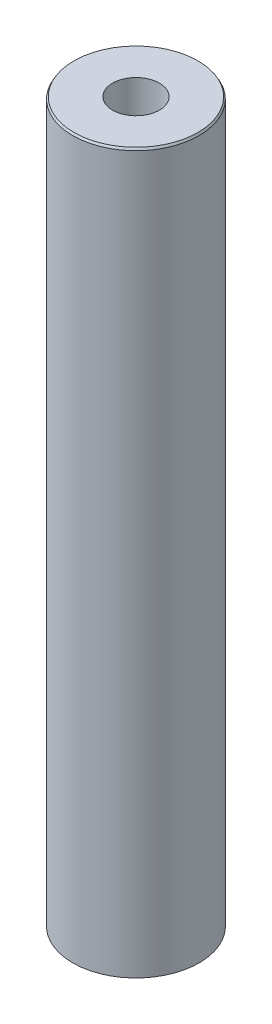
from build123d import *
from OCP.BRepFilletAPI import BRepFilletAPI_MakeChamfer

# Parameters (mm, degrees)
SKETCH1_R           = 50
BOSS_EXTRUDE1_DEPTH = 568.919930684
SKETCH2_R           = 18.52179034
CUT_EXTRUDE1_DEPTH  = 574.297381408
CHAMFER1_SIZE       = 1.673068569
CHAMFER1_SIZE2      = 0.965946588


with BuildPart() as part:
    # Sketch1 → Boss-Extrude1 (new body)
    with BuildSketch(Plane(origin=(0, 0, 0), x_dir=(1, 0, 0), z_dir=(0, 1, 0))):
        Circle(SKETCH1_R)
    extrude(amount=BOSS_EXTRUDE1_DEPTH)

    # Sketch2 → Cut-Extrude1 (cut, through all)
    with BuildSketch(Plane(origin=(0, 0, 0), x_dir=(1, 0, 0), z_dir=(0, 1, 0))):
        Circle(SKETCH2_R)
    extrude(amount=CUT_EXTRUDE1_DEPTH, mode=Mode.SUBTRACT)

    # Chamfer1: one chamfer whose edges measure the first distance from different faces: ONE call of the kernel's chamfer builder (chamfer() names one face for all edges)
    chamfer1_edges_1 = [part.edges().sort_by_distance(p)[0] for p in [
        (-50, 568.919930684, 0),
    ]]
    chamfer1_side_1 = [part.faces().sort_by_distance(p)[0] for p in [
        (-50, 284.459965342, 0),
    ]]
    chamfer1_edges_2 = [part.edges().sort_by_distance(p)[0] for p in [
        (-50, 0, 0),
    ]]
    chamfer1_side_2 = [part.faces().sort_by_distance(p)[0] for p in [
        (-48.585786438, 0, 0),
    ]]
    chamfer1 = BRepFilletAPI_MakeChamfer(part.part.solid().wrapped)
    for e in chamfer1_edges_1:
        chamfer1.Add(CHAMFER1_SIZE, CHAMFER1_SIZE2, e.wrapped, chamfer1_side_1[0].wrapped)  # the first distance lies on this face
    for e in chamfer1_edges_2:
        chamfer1.Add(CHAMFER1_SIZE, CHAMFER1_SIZE2, e.wrapped, chamfer1_side_2[0].wrapped)  # the first distance lies on this face
    add(Compound.cast(chamfer1.Shape()), mode=Mode.REPLACE)


solid = part.part
